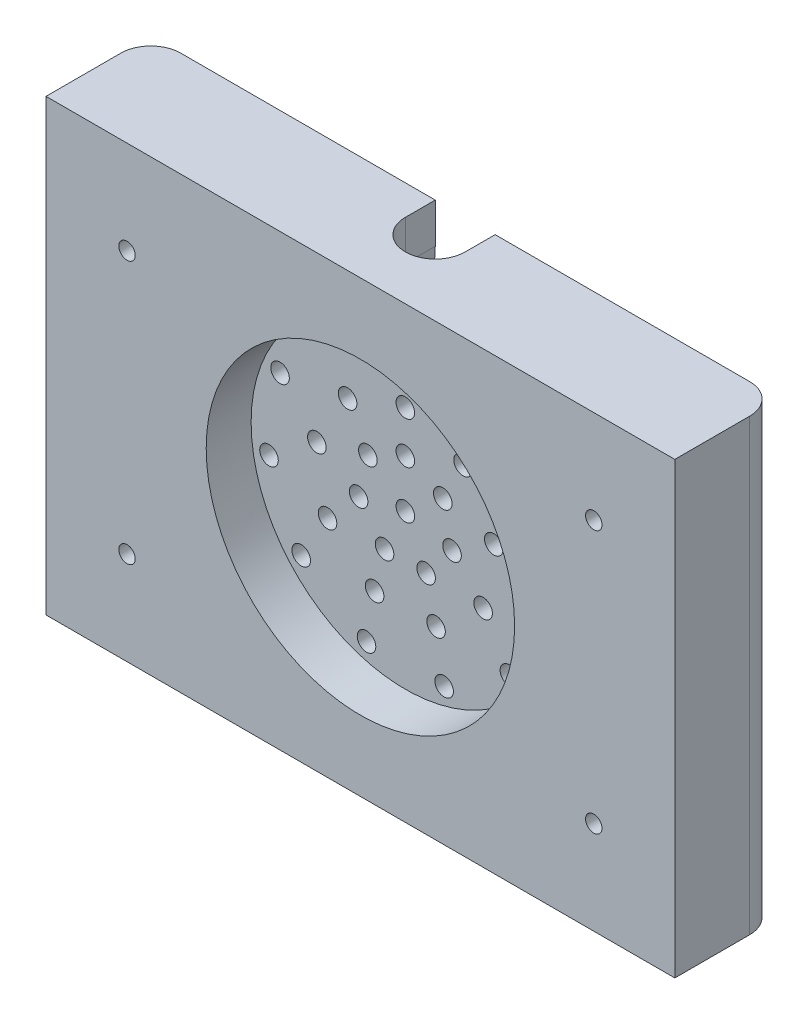
from build123d import *

# Parameters (mm, degrees)
SKETCH1_R                                 = 56
BOSS_EXTRUDE1_DEPTH                       = 25
SKETCH2_W                                 = 210
SKETCH2_H                                 = 150
SKETCH2_R                                 = 51.5
BOSS_EXTRUDE2_DEPTH                       = 35
SKETCH3_R                                 = 3.1
CUT_EXTRUDE1_DEPTH                        = 132.434394281
SKETCH7_R                                 = 51.5
CUT_EXTRUDE2_DEPTH                        = 15
CBORE_FOR_M5_HEX_BOLT_GRADE_C1_AT_2_COUNT = 2
CBORE_FOR_M5_HEX_BOLT_GRADE_C1_AT_2_PITCH = 87.749643874
CBORE_FOR_M5_HEX_BOLT_GRADE_C1_AT_3_COUNT = 2
CBORE_FOR_M5_HEX_BOLT_GRADE_C1_AT_3_PITCH = 155.884572681
CBORE_FOR_M5_HEX_BOLT_GRADE_C1_AT_4_COUNT = 2
CBORE_FOR_M5_HEX_BOLT_GRADE_C1_AT_4_PITCH = 178.8854382
SKETCH17_W                                = 20
SKETCH17_H                                = 40
CUT_EXTRUDE4_DEPTH                        = 10
SKETCH18_R                                = 10
CUT_EXTRUDE5_DEPTH                        = 22.5
FILLET6_R                                 = 10


with BuildPart() as part:
    # Sketch1 → Boss-Extrude1 (new body)
    with BuildSketch(Plane.XY):
        Circle(SKETCH1_R)
    extrude(amount=BOSS_EXTRUDE1_DEPTH)

    # Sketch2 → Boss-Extrude2 (add)
    with BuildSketch(Plane.XY.offset(25)):
        Rectangle(SKETCH2_W, SKETCH2_H)
        Circle(SKETCH2_R, mode=Mode.SUBTRACT)
    extrude(amount=-BOSS_EXTRUDE2_DEPTH)

    # Sketch3 → Cut-Extrude1 (cut, through all)
    with BuildSketch(Plane(origin=(0, 0, 0), x_dir=(-1, 0, 0), z_dir=(0, 0, -1))):
        with Locations((0, 46)):
            Circle(SKETCH3_R)
        with Locations((0, 30)):
            Circle(SKETCH3_R)
        with Locations((0, 16)):
            Circle(SKETCH3_R)
        with Locations((12.509303719, 9.97583683)):
            Circle(SKETCH3_R)
        with Locations((15.598846595, -3.560334943)):
            Circle(SKETCH3_R)
        with Locations((6.942139826, -14.415501886)):
            Circle(SKETCH3_R)
        with Locations((-6.942139826, -14.415501886)):
            Circle(SKETCH3_R)
        with Locations((-15.598846595, -3.560334943)):
            Circle(SKETCH3_R)
        with Locations((-12.509303719, 9.97583683)):
            Circle(SKETCH3_R)
        with Locations((19.283628291, 22.981333294)):
            Circle(SKETCH3_R)
        with Locations((29.54423259, 5.20944533)):
            Circle(SKETCH3_R)
        with Locations((25.980762114, -15)):
            Circle(SKETCH3_R)
        with Locations((10.2606043, -28.190778624)):
            Circle(SKETCH3_R)
        with Locations((-10.2606043, -28.190778624)):
            Circle(SKETCH3_R)
        with Locations((-25.980762114, -15)):
            Circle(SKETCH3_R)
        with Locations((-29.54423259, 5.20944533)):
            Circle(SKETCH3_R)
        with Locations((-19.283628291, 22.981333294)):
            Circle(SKETCH3_R)
        with Locations((24.869477603, 38.69766251)):
            Circle(SKETCH3_R)
        with Locations((41.843071786, 19.109090598)):
            Circle(SKETCH3_R)
        with Locations((45.531786327, -6.546482561)):
            Circle(SKETCH3_R)
        with Locations((34.76448042, -30.123593761)):
            Circle(SKETCH3_R)
        with Locations((12.959697615, -44.136676786)):
            Circle(SKETCH3_R)
        with Locations((-12.959697615, -44.136676786)):
            Circle(SKETCH3_R)
        with Locations((-34.76448042, -30.123593761)):
            Circle(SKETCH3_R)
        with Locations((-45.531786327, -6.546482561)):
            Circle(SKETCH3_R)
        with Locations((-41.843071786, 19.109090598)):
            Circle(SKETCH3_R)
        with Locations((-24.869477603, 38.69766251)):
            Circle(SKETCH3_R)
        Circle(SKETCH3_R)
    extrude(amount=-CUT_EXTRUDE1_DEPTH, mode=Mode.SUBTRACT)

    # Sketch7 → Cut-Extrude2 (cut)
    with BuildSketch(Plane.XY.offset(25)):
        Circle(SKETCH7_R)
    extrude(amount=-CUT_EXTRUDE2_DEPTH, mode=Mode.SUBTRACT)

    # Sketch12 → CBORE for M5 Hex Bolt Grade C1 (revolve, cut)
    with BuildSketch(Plane(origin=(77.942286341, 43.874821937, -10), x_dir=(0, 1, 0), z_dir=(1, 0, 0))):
        Polygon((0, 0), (0, 35), (2.75, 35), (2.75, 3.5), (6.119, 3.5), (6.119, 0.024142219), (6.144, 0), align=None)
    cbore_for_m5_hex_bolt_grade_c1 = revolve(axis=Axis((77.942286341, 43.874821937, -16.35), (0, 0, 1)), mode=Mode.SUBTRACT)

    # CBORE for M5 Hex Bolt Grade C1 at 2: CBORE for M5 Hex Bolt Grade C1 ×2
    with Locations(*[(0, -i * CBORE_FOR_M5_HEX_BOLT_GRADE_C1_AT_2_PITCH, 0) for i in range(1, CBORE_FOR_M5_HEX_BOLT_GRADE_C1_AT_2_COUNT)]):
        add(cbore_for_m5_hex_bolt_grade_c1, mode=Mode.SUBTRACT)

    # CBORE for M5 Hex Bolt Grade C1 at 3: CBORE for M5 Hex Bolt Grade C1 ×2
    with Locations(*[(-i * CBORE_FOR_M5_HEX_BOLT_GRADE_C1_AT_3_PITCH, 0, 0) for i in range(1, CBORE_FOR_M5_HEX_BOLT_GRADE_C1_AT_3_COUNT)]):
        add(cbore_for_m5_hex_bolt_grade_c1, mode=Mode.SUBTRACT)

    # CBORE for M5 Hex Bolt Grade C1 at 4: CBORE for M5 Hex Bolt Grade C1 ×2
    with Locations(*[Vector(-0.8714212528966683, -0.4905354217587157, 0) * (i * CBORE_FOR_M5_HEX_BOLT_GRADE_C1_AT_4_PITCH) for i in range(1, CBORE_FOR_M5_HEX_BOLT_GRADE_C1_AT_4_COUNT)]):
        add(cbore_for_m5_hex_bolt_grade_c1, mode=Mode.SUBTRACT)

    # Sketch17 → Cut-Extrude4 (cut)
    with BuildSketch(Plane(origin=(0, 0, -10), x_dir=(-1, 0, 0), z_dir=(0, 0, -1))):
        with Locations((0, 65.672027366)):
            Rectangle(SKETCH17_W, SKETCH17_H)
    extrude(amount=-CUT_EXTRUDE4_DEPTH, mode=Mode.SUBTRACT)

    # Sketch18 → Cut-Extrude5 (cut)
    with BuildSketch(Plane(origin=(0, 75, 0), x_dir=(1, 0, 0), z_dir=(0, 1, 0))):
        Circle(SKETCH18_R)
    extrude(amount=-CUT_EXTRUDE5_DEPTH, mode=Mode.SUBTRACT)

    # Fillet6
    fillet6_edges = [part.edges().sort_by_distance(p)[0] for p in [
        (-105, 0, -10),
        (105, 0, -10),
    ]]
    fillet(fillet6_edges, radius=FILLET6_R)

    # Fillet7
    # a fillet whose section is not a circle: 15 mm, written as the material it takes off along each edge
    with BuildSketch(Plane(origin=(10, 50.519798099, -37.75508112), x_dir=(0, 1, 0), z_dir=(0, 0, 1))) as fillet7_piece_1:
        with BuildLine():
            Bezier((11.102032448, 0), (1.000093014, 0), (-2.797628578, -9.360902256), weights=[1, 1.5, 1])
            ThreePointArc((-2.797628578, -9.360902256), (-1.176331731, -4.746942962), (0, 0))
            Line((0, 0), (11.102032448, 0))
        make_face()
    extrude(amount=37.75508112, mode=Mode.SUBTRACT)
    with BuildSketch(Plane(origin=(-10, 50.519798099, -37.75508112), x_dir=(0, 1, 0), z_dir=(0, 0, 1))) as fillet7_piece_2:
        with BuildLine():
            Bezier((11.102032448, 0), (1.000093014, 0), (-2.797628578, 9.360902256), weights=[1, 1.5, 1])
            ThreePointArc((-2.797628578, 9.360902256), (-1.176331731, 4.746942962), (0, 0))
            Line((0, 0), (11.102032448, 0))
        make_face()
    extrude(amount=37.75508112, mode=Mode.SUBTRACT)


solid = part.part
